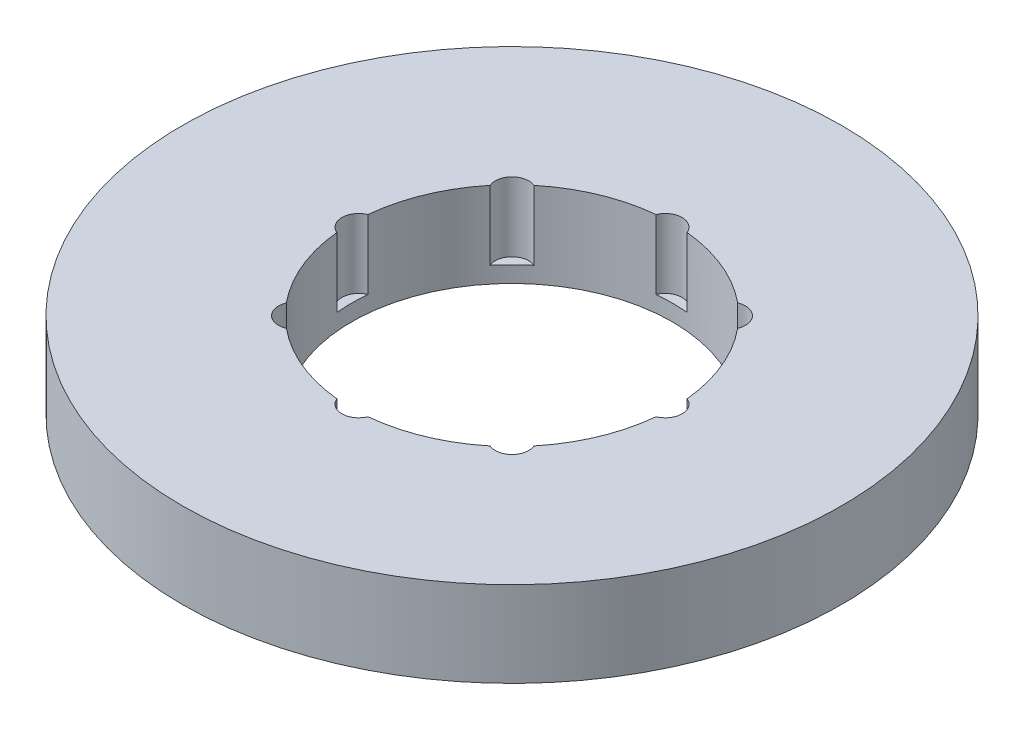
from build123d import *

# Parameters (mm, degrees)
SKETCH1_R           = 92.5
BOSS_EXTRUDE1_DEPTH = 24
SKETCH2_R           = 45
CUT_EXTRUDE1_DEPTH  = 133.998120287
SKETCH3_R           = 4.707721969
CUT_EXTRUDE2_DEPTH  = 19.437471733
CIRPATTERN1_COUNT   = 8


with BuildPart() as part:
    # Sketch1 → Boss-Extrude1 (new body)
    with BuildSketch(Plane(origin=(0, 0, 0), x_dir=(1, 0, 0), z_dir=(0, 1, 0))):
        Circle(SKETCH1_R)
    extrude(amount=BOSS_EXTRUDE1_DEPTH)

    # Sketch2 → Cut-Extrude1 (cut, through all)
    with BuildSketch(Plane(origin=(0, 0, 0), x_dir=(1, 0, 0), z_dir=(0, 1, 0))):
        Circle(SKETCH2_R)
    extrude(amount=CUT_EXTRUDE1_DEPTH, mode=Mode.SUBTRACT)

    # Sketch3 → Cut-Extrude2 (cut)
    with BuildSketch(Plane(origin=(0, 24, 0), x_dir=(1, 0, 0), z_dir=(0, 1, 0))):
        with Locations((-43.024276092, 0)):
            Circle(SKETCH3_R)
    cut_extrude2 = extrude(amount=-CUT_EXTRUDE2_DEPTH, mode=Mode.SUBTRACT)

    # CirPattern1: Cut-Extrude2 ×8 about axis
    cirpattern1_axis = Axis((0, 0, 0), (0, 1, 0))
    for i in range(1, CIRPATTERN1_COUNT):
        add(cut_extrude2.rotate(cirpattern1_axis, i * 360 / CIRPATTERN1_COUNT), mode=Mode.SUBTRACT)


solid = part.part
